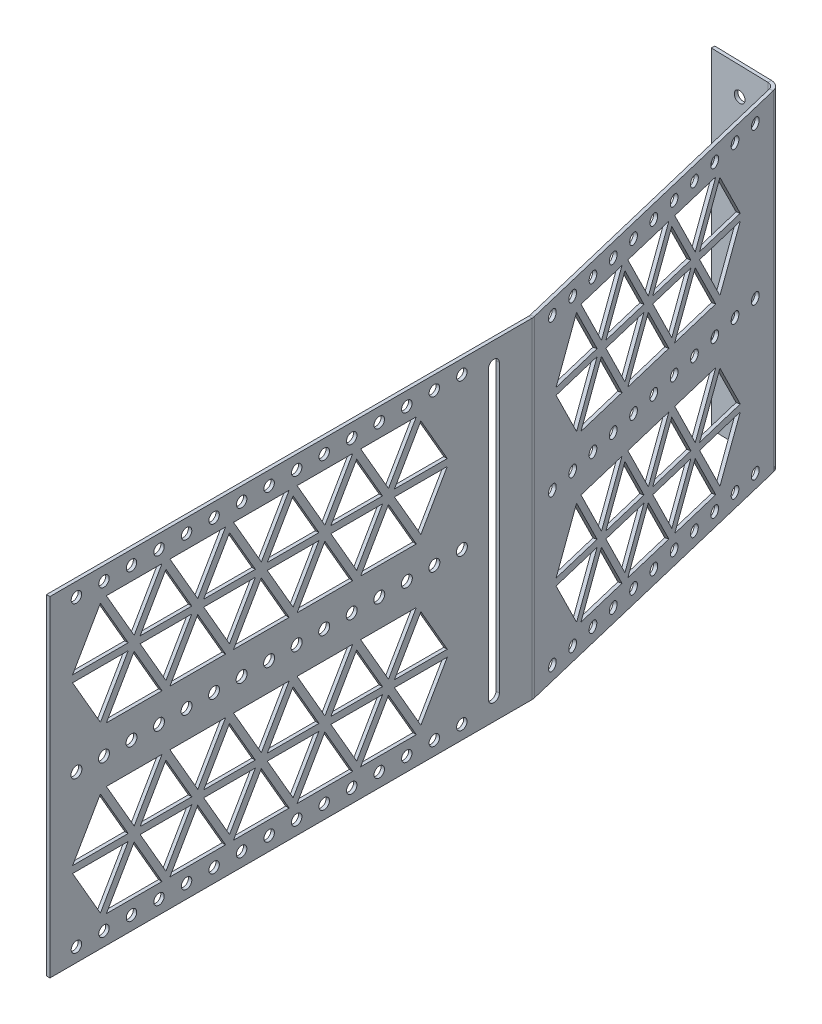
from build123d import *

# Parameters (mm, degrees)
BASE_FLANGE1_DEPTH           = 152.4
EDGE_FLANGE1_STRIP_CUT_DEPTH = 152.4
EDGE_FLANGE1_DEPTH           = 152.4
CUT_EXTRUDE1_DEPTH           = 2.54
CUT_EXTRUDE3_DEPTH           = 1.5875
EXTRUDE_THIN2_DEPTH          = 1.5875
SKETCH21_W                   = 174.683562243
SKETCH21_H                   = 3.175
EXTRUDE_THIN4_DEPTH          = 1.5875
MIRROR2_COPY_1_DEPTH         = 1.5875
SKETCH22_R                   = 2.413
CUT_EXTRUDE4_DEPTH           = 1.5875
SKETCH23_R                   = 2.54
CUT_EXTRUDE5_DEPTH           = 1.5875
CUT_EXTRUDE6_DEPTH           = 1.5875
EXTRUDE_THIN5_DEPTH          = 1.5875
SKETCH26_W                   = 117.073685711
SKETCH26_H                   = 3.175
EXTRUDE_THIN6_DEPTH          = 1.5875
MIRROR5_COPY_1_DEPTH         = 1.5875
SKETCH27_R                   = 2.413
CUT_EXTRUDE7_DEPTH           = 1.5875
SKETCH28_R                   = 2.413
CUT_EXTRUDE8_DEPTH           = 1.5875
SKETCH29_R                   = 2.54
CUT_EXTRUDE9_DEPTH           = 1.5875


# Sheet-metal steps are written as plain solids
with BuildPart() as part:
    # Sketch1 → Base-Flange1 (new body)
    with BuildSketch(Plane(origin=(0, -152.479375, 0), x_dir=(1, 0, 0), z_dir=(0, 1, 0))):
        with BuildLine():
            Line((-170.723040027, 769.969442778), (-135.02627141, 622.197951423))
            ThreePointArc((-135.02627141, 622.197951423), (-134.959770962, 621.827818611), (-134.9375, 621.452419339))
            Line((-134.9375, 621.452419339), (-134.9375, 398.991457096))
            Line((-134.9375, 398.991457096), (-133.35, 398.991457096))
            Line((-133.35, 398.991457096), (-133.35, 621.452419339))
            ThreePointArc((-133.35, 621.452419339), (-133.383406443, 622.015518246), (-133.483157114, 622.570717465))
            Line((-133.483157114, 622.570717465), (-169.179925732, 770.34220882))
            Line((-169.179925732, 770.34220882), (-170.723040027, 769.969442778))
        make_face()
    extrude(amount=BASE_FLANGE1_DEPTH)

    # Edge-Flange1 strip (across the edge) → Edge-Flange1 strip cut (cut)
    with BuildSketch(Plane(origin=(-170.723040027, -0.079375, -769.969442778), x_dir=(-0.02477040710556338, 0, 0.999693166392481), z_dir=(0, -1, 0))):
        Polygon((-10.324883696, 1.123043312), (1.942374298, -2.163958561), (2.353249532, -0.630551312), (-9.914008462, 2.656450561), align=None)
    extrude(amount=EDGE_FLANGE1_STRIP_CUT_DEPTH, mode=Mode.SUBTRACT)

    # Edge-Flange1 section (across the edge) → Edge-Flange1 (add)
    with BuildSketch(Plane(origin=(-170.723040027, -0.079375, -769.969442778), x_dir=(-0.02477040710556338, 0, 0.999693166392481), z_dir=(0, -1, 0))):
        with BuildLine():
            Line((-1.5875, 2.436263187), (-1.5875, 29.261868407))
            Line((-1.5875, 29.261868407), (0, 29.261868407))
            Line((0, 29.261868407), (0, 2.436263187))
            ThreePointArc((0, 2.436263187), (0.656103145, 0.50344565), (2.353249532, -0.630551312))
            Line((2.353249532, -0.630551312), (1.942374298, -2.163958561))
            ThreePointArc((1.942374298, -2.163958561), (-0.603345283, -0.462963119), (-1.5875, 2.436263187))
        make_face()
    extrude(amount=EDGE_FLANGE1_DEPTH)

    # Sketch17 → Cut-Extrude1 (cut)
    with BuildSketch(Plane(origin=(-133.35, 0, 0), x_dir=(0, 0, -1), z_dir=(1, 0, 0))):
        with BuildLine():
            Line((606.314019339, -10.239375), (606.314019339, -142.319375))
            ThreePointArc((606.314019339, -142.319375), (603.774019339, -144.859375), (601.234019339, -142.319375))
            Line((601.234019339, -142.319375), (601.234019339, -10.239375))
            ThreePointArc((601.234019339, -10.239375), (603.774019339, -7.699375), (606.314019339, -10.239375))
        make_face()
    extrude(amount=-CUT_EXTRUDE1_DEPTH, mode=Mode.SUBTRACT)

    # Sketch18 → Cut-Extrude3 (cut)
    with BuildSketch(Plane(origin=(-133.35, 0, 0), x_dir=(0, 0, -1), z_dir=(1, 0, 0))):
        Polygon((423.181153933, -88.979375), (408.516457096, -114.379375), (423.181153933, -139.779375), (568.535322502, -139.779375), (583.200019339, -114.379375), (568.535322502, -88.979375), align=None)
    cut_extrude3 = extrude(amount=-CUT_EXTRUDE3_DEPTH, mode=Mode.SUBTRACT)

    # Sketch19 → Extrude-Thin2 (add)
    with BuildSketch(Plane(origin=(-133.35, 0, 0), x_dir=(0, 0, -1), z_dir=(1, 0, 0))):
        Polygon((424.555969261, -140.573125), (452.510547608, -92.154375), (481.839941283, -142.954375), (511.169334957, -92.154375), (540.498728632, -142.954375), (571.202937636, -89.773125), (568.453306979, -88.185625), (540.498728632, -136.604375), (511.169334957, -85.804375), (481.839941283, -136.604375), (452.510547608, -85.804375), (421.806338604, -138.985625), align=None)
    extrude_thin2 = extrude(amount=-EXTRUDE_THIN2_DEPTH)

    # Mirror1: Extrude-Thin2 across plane
    add(extrude_thin2.mirror(Plane.ZX.offset(-114.379375)))

    # Sketch21 → Extrude-Thin4 (add)
    with BuildSketch(Plane(origin=(-133.35, 0, 0), x_dir=(0, 0, -1), z_dir=(1, 0, 0))):
        with Locations((495.858238218, -114.379375)):
            Rectangle(SKETCH21_W, SKETCH21_H)
    extrude_thin4 = extrude(amount=-EXTRUDE_THIN4_DEPTH)

    # Mirror2: Cut-Extrude3, Extrude-Thin2, Extrude-Thin4 across plane
    add(cut_extrude3.mirror(Plane.ZX.offset(-76.279375)), mode=Mode.SUBTRACT)
    add(extrude_thin2.mirror(Plane.ZX.offset(-76.279375)))
    add(extrude_thin4.mirror(Plane.ZX.offset(-76.279375)))

    # Mirror2 copy 1 sketch → Mirror2 copy 1 (add)
    with BuildSketch(Plane(origin=(-133.35, 76.2, 0), x_dir=(0, 0, -1), z_dir=(1, 0, 0))):
        Polygon((424.555969261, -140.573125), (452.510547608, -92.154375), (481.839941283, -142.954375), (511.169334957, -92.154375), (540.498728632, -142.954375), (571.202937636, -89.773125), (568.453306979, -88.185625), (540.498728632, -136.604375), (511.169334957, -85.804375), (481.839941283, -136.604375), (452.510547608, -85.804375), (421.806338604, -138.985625), align=None)
    extrude(amount=-MIRROR2_COPY_1_DEPTH)

    # Sketch22 → Cut-Extrude4 (cut)
    with BuildSketch(Plane(origin=(-133.35, 0, 0), x_dir=(0, 0, -1), z_dir=(1, 0, 0))):
        with Locations((411.212738217, -6.429375)):
            Circle(SKETCH22_R)
        with Locations((423.912738217, -6.429375)):
            Circle(SKETCH22_R)
        with Locations((436.612738217, -6.429375)):
            Circle(SKETCH22_R)
        with Locations((449.312738217, -6.429375)):
            Circle(SKETCH22_R)
        with Locations((462.012738217, -6.429375)):
            Circle(SKETCH22_R)
        with Locations((474.712738217, -6.429375)):
            Circle(SKETCH22_R)
        with Locations((487.412738217, -6.429375)):
            Circle(SKETCH22_R)
        with Locations((500.112738217, -6.429375)):
            Circle(SKETCH22_R)
        with Locations((512.812738217, -6.429375)):
            Circle(SKETCH22_R)
        with Locations((525.512738217, -6.429375)):
            Circle(SKETCH22_R)
        with Locations((538.212738217, -6.429375)):
            Circle(SKETCH22_R)
        with Locations((550.912738217, -6.429375)):
            Circle(SKETCH22_R)
        with Locations((563.612738217, -6.429375)):
            Circle(SKETCH22_R)
        with Locations((576.312738217, -6.429375)):
            Circle(SKETCH22_R)
        with Locations((589.012738217, -6.429375)):
            Circle(SKETCH22_R)
    cut_extrude4 = extrude(amount=-CUT_EXTRUDE4_DEPTH, mode=Mode.SUBTRACT)

    # Mirror3: Cut-Extrude4 across plane
    add(cut_extrude4.mirror(Plane.ZX.offset(-76.279375)), mode=Mode.SUBTRACT)

    # Sketch23 → Cut-Extrude5 (cut)
    with BuildSketch(Plane(origin=(-133.35, 0, 0), x_dir=(0, 0, -1), z_dir=(1, 0, 0))):
        with Locations((411.212738217, -76.279375)):
            Circle(SKETCH23_R)
        with Locations((423.912738217, -76.279375)):
            Circle(SKETCH23_R)
        with Locations((436.612738217, -76.279375)):
            Circle(SKETCH23_R)
        with Locations((449.312738217, -76.279375)):
            Circle(SKETCH23_R)
        with Locations((462.012738217, -76.279375)):
            Circle(SKETCH23_R)
        with Locations((474.712738217, -76.279375)):
            Circle(SKETCH23_R)
        with Locations((487.412738217, -76.279375)):
            Circle(SKETCH23_R)
        with Locations((500.112738217, -76.279375)):
            Circle(SKETCH23_R)
        with Locations((512.812738217, -76.279375)):
            Circle(SKETCH23_R)
        with Locations((525.512738217, -76.279375)):
            Circle(SKETCH23_R)
        with Locations((538.212738217, -76.279375)):
            Circle(SKETCH23_R)
        with Locations((550.912738217, -76.279375)):
            Circle(SKETCH23_R)
        with Locations((563.612738217, -76.279375)):
            Circle(SKETCH23_R)
        with Locations((576.312738217, -76.279375)):
            Circle(SKETCH23_R)
        with Locations((589.012738217, -76.279375)):
            Circle(SKETCH23_R)
    extrude(amount=-CUT_EXTRUDE5_DEPTH, mode=Mode.SUBTRACT)

    # Sketch24 → Cut-Extrude6 (cut)
    with BuildSketch(Plane(origin=(15.977256291, 0, -3.859583576), x_dir=(-0.23481325477026344, 0, -0.972040500897054), z_dir=(0.972040500897054, 0, -0.23481325477026344))):
        Polygon((766.281252339, -38.179375), (751.616555502, -12.779375), (663.872263465, -12.779375), (649.207566628, -38.179375), (663.872263465, -63.579375), (751.616555502, -63.579375), align=None)
    cut_extrude6 = extrude(amount=-CUT_EXTRUDE6_DEPTH, mode=Mode.SUBTRACT)

    # Sketch25 → Extrude-Thin5 (add)
    with BuildSketch(Plane(origin=(15.977256291, 0, -3.859583576), x_dir=(-0.23481325477026344, 0, -0.972040500897054), z_dir=(0.972040500897054, 0, -0.23481325477026344))):
        Polygon((662.497448137, -13.573125), (693.20165714, -66.754375), (722.531050815, -15.954375), (750.485629161, -64.373125), (753.235259818, -62.785625), (722.531050815, -9.604375), (693.20165714, -60.404375), (665.247078794, -11.985625), align=None)
    extrude_thin5 = extrude(amount=-EXTRUDE_THIN5_DEPTH)

    # Mirror4: Extrude-Thin5 across plane
    add(extrude_thin5.mirror(Plane.ZX.offset(-38.179375)))

    # Sketch26 → Extrude-Thin6 (add)
    with BuildSketch(Plane(origin=(15.977256291, 0, -3.859583576), x_dir=(-0.23481325477026344, 0, -0.972040500897054), z_dir=(0.972040500897054, 0, -0.23481325477026344))):
        with Locations((707.744409484, -38.179375)):
            Rectangle(SKETCH26_W, SKETCH26_H)
    extrude_thin6 = extrude(amount=-EXTRUDE_THIN6_DEPTH)

    # Mirror5: Cut-Extrude6, Extrude-Thin5, Extrude-Thin6 across plane
    add(cut_extrude6.mirror(Plane.ZX.offset(-76.279375)), mode=Mode.SUBTRACT)
    add(extrude_thin5.mirror(Plane.ZX.offset(-76.279375)))
    add(extrude_thin6.mirror(Plane.ZX.offset(-76.279375)))

    # Mirror5 copy 1 sketch → Mirror5 copy 1 (add)
    with BuildSketch(Plane(origin=(15.977256291, -76.2, -3.859583576), x_dir=(-0.23481325477026344, 0, -0.972040500897054), z_dir=(0.972040500897054, 0, -0.23481325477026344))):
        Polygon((662.497448137, -13.573125), (693.20165714, -66.754375), (722.531050815, -15.954375), (750.485629161, -64.373125), (753.235259818, -62.785625), (722.531050815, -9.604375), (693.20165714, -60.404375), (665.247078794, -11.985625), align=None)
    extrude(amount=-MIRROR5_COPY_1_DEPTH)

    # Sketch27 → Cut-Extrude7 (cut)
    with BuildSketch(Plane(origin=(15.977256291, 0, -3.859583576), x_dir=(-0.23481325477026344, 0, -0.972040500897054), z_dir=(0.972040500897054, 0, -0.23481325477026344))):
        with Locations((647.800409484, -6.429375)):
            Circle(SKETCH27_R)
        with Locations((660.500409484, -6.429375)):
            Circle(SKETCH27_R)
        with Locations((673.200409484, -6.429375)):
            Circle(SKETCH27_R)
        with Locations((685.900409484, -6.429375)):
            Circle(SKETCH27_R)
        with Locations((698.600409484, -6.429375)):
            Circle(SKETCH27_R)
        with Locations((711.300409484, -6.429375)):
            Circle(SKETCH27_R)
        with Locations((724.000409484, -6.429375)):
            Circle(SKETCH27_R)
        with Locations((736.700409484, -6.429375)):
            Circle(SKETCH27_R)
        with Locations((749.400409484, -6.429375)):
            Circle(SKETCH27_R)
        with Locations((762.100409484, -6.429375)):
            Circle(SKETCH27_R)
        with Locations((774.800409484, -6.429375)):
            Circle(SKETCH27_R)
    cut_extrude7 = extrude(amount=-CUT_EXTRUDE7_DEPTH, mode=Mode.SUBTRACT)

    # Mirror6: Cut-Extrude7 across plane
    add(cut_extrude7.mirror(Plane.ZX.offset(-76.279375)), mode=Mode.SUBTRACT)

    # Sketch28 → Cut-Extrude8 (cut)
    with BuildSketch(Plane(origin=(15.977256291, 0, -3.859583576), x_dir=(-0.23481325477026344, 0, -0.972040500897054), z_dir=(0.972040500897054, 0, -0.23481325477026344))):
        with Locations((647.800409484, -76.279375)):
            Circle(SKETCH28_R)
        with Locations((660.500409484, -76.279375)):
            Circle(SKETCH28_R)
        with Locations((673.200409484, -76.279375)):
            Circle(SKETCH28_R)
        with Locations((685.900409484, -76.279375)):
            Circle(SKETCH28_R)
        with Locations((698.600409484, -76.279375)):
            Circle(SKETCH28_R)
        with Locations((711.300409484, -76.279375)):
            Circle(SKETCH28_R)
        with Locations((724.000409484, -76.279375)):
            Circle(SKETCH28_R)
        with Locations((736.700409484, -76.279375)):
            Circle(SKETCH28_R)
        with Locations((749.400409484, -76.279375)):
            Circle(SKETCH28_R)
        with Locations((762.100409484, -76.279375)):
            Circle(SKETCH28_R)
        with Locations((774.800409484, -76.279375)):
            Circle(SKETCH28_R)
    extrude(amount=-CUT_EXTRUDE8_DEPTH, mode=Mode.SUBTRACT)

    # Sketch29 → Cut-Extrude9 (cut)
    with BuildSketch(Plane(origin=(19.001176448, 0, -766.856441525), x_dir=(-0.9996931663924811, 0, -0.024770407105563826), z_dir=(0.024770407105563826, 0, -0.9996931663924811))):
        with Locations((205.592178814, -12.779375)):
            Circle(SKETCH29_R)
        with Locations((205.592178814, -25.479375)):
            Circle(SKETCH29_R)
        with Locations((205.592178814, -38.179375)):
            Circle(SKETCH29_R)
        with Locations((205.592178814, -50.879375)):
            Circle(SKETCH29_R)
        with Locations((205.592178814, -63.579375)):
            Circle(SKETCH29_R)
        with Locations((205.592178814, -76.279375)):
            Circle(SKETCH29_R)
        with Locations((205.592178814, -88.979375)):
            Circle(SKETCH29_R)
        with Locations((205.592178814, -101.679375)):
            Circle(SKETCH29_R)
        with Locations((205.592178814, -114.379375)):
            Circle(SKETCH29_R)
        with Locations((205.592178814, -127.079375)):
            Circle(SKETCH29_R)
        with Locations((205.592178814, -139.779375)):
            Circle(SKETCH29_R)
    extrude(amount=-CUT_EXTRUDE9_DEPTH, mode=Mode.SUBTRACT)


solid = part.part
